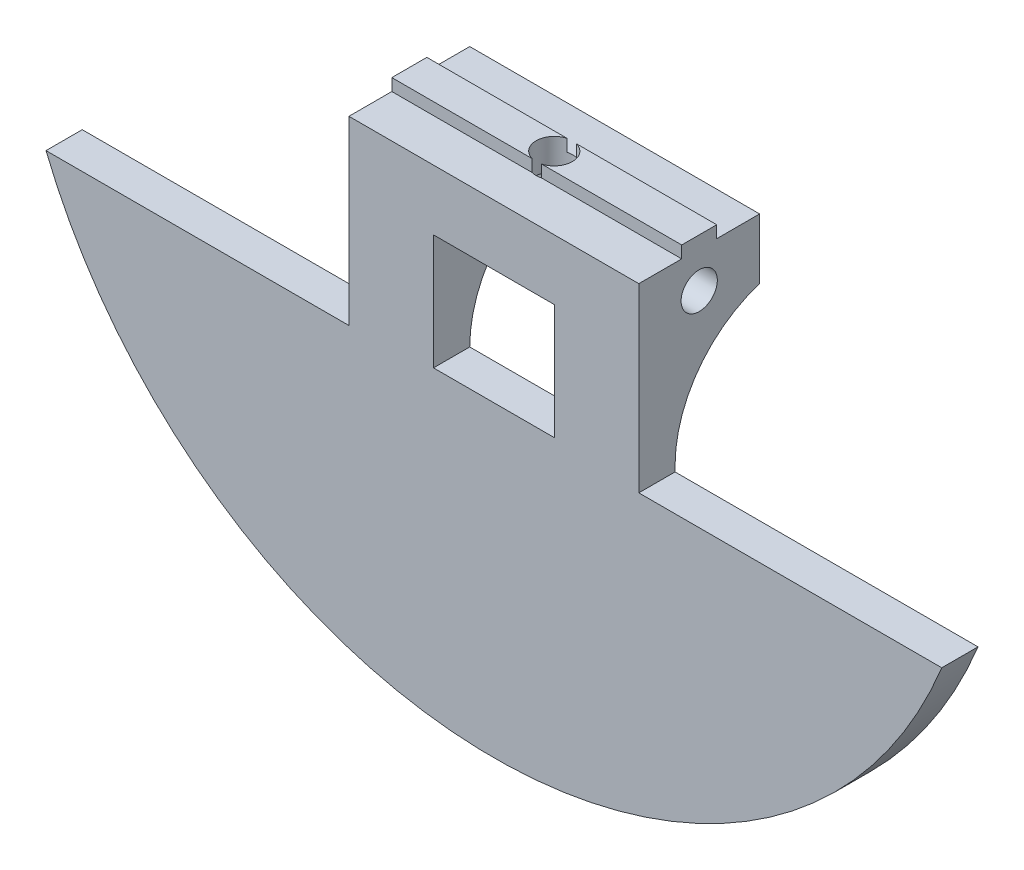
from build123d import *

# Parameters (mm, degrees)
BOSS_EXTRUDE1_DEPTH     = 10
SKETCH2_W               = 2.9
SKETCH2_H               = 1
BOSS_EXTRUDE2_DEPTH     = 24
SKETCH3_R               = 1.5
CUT_EXTRUDE1_DEPTH      = 57.178287621
CUT_EXTRUDE2_DEPTH      = 56.452682697
CUT_EXTRUDE2_DEPTH_BACK = 56.452682697
SKETCH5_W               = 7
SKETCH5_H               = 35
FILLET1_START           = 1.5000001
FILLET1_DEPTH           = 10.4999999
FILLET1_START_2         = -12
FILLET1_2_DEPTH         = 10.499986243
FILLET1_START_3         = -1.500013757
FILLET1_3_DEPTH         = 3.000013857
FILLET1_4_OUTLINE_W     = 1.5
FILLET1_4_OUTLINE_H     = 6.418167134
SKETCH6_W               = 10
SKETCH6_H               = 9.539392014
CUT_EXTRUDE3_DEPTH      = 56.452682532
SKETCH7_R               = 1.5
CUT_EXTRUDE4_DEPTH      = 65.101043817


with BuildPart() as part:
    # Sketch1 → Boss-Extrude1 (new body)
    with BuildSketch(Plane.XY):
        with BuildLine():
            Line((-37.080992435, -15), (-12, -15))
            Line((-12, -15), (-12, 0))
            Line((-12, 0), (12, 0))
            Line((12, 0), (12, -15))
            Line((12, -15), (37.080992435, -15))
            ThreePointArc((37.080992435, -15), (0, -40), (-37.080992435, -15))
        make_face()
    extrude(amount=BOSS_EXTRUDE1_DEPTH)

    # Sketch2 → Boss-Extrude2 (add)
    with BuildSketch(Plane(origin=(12, 0, 0), x_dir=(0, 0, -1), z_dir=(1, 0, 0))):
        with Locations((-5, 0.5)):
            Rectangle(SKETCH2_W, SKETCH2_H)
    extrude(amount=-BOSS_EXTRUDE2_DEPTH)

    # Sketch3 → Cut-Extrude1 (cut, through all)
    with BuildSketch(Plane(origin=(0, 1, 0), x_dir=(1, 0, 0), z_dir=(0, 1, 0))):
        with Locations(Location((0, -5, 0), (0, 0, 270))):
            Circle(SKETCH3_R)
    extrude(amount=-CUT_EXTRUDE1_DEPTH, mode=Mode.SUBTRACT)

    # Sketch5 → Cut-Extrude2 (cut, two sides: drawn at the far end of the back side and taken through both)
    with BuildSketch(Plane(origin=(0, 0, 0), x_dir=(0, 0, -1), z_dir=(1, 0, 0)).offset(-CUT_EXTRUDE2_DEPTH_BACK)):
        with Locations((-3.5, -22.5)):
            Rectangle(SKETCH5_W, SKETCH5_H)
    extrude(amount=CUT_EXTRUDE2_DEPTH + CUT_EXTRUDE2_DEPTH_BACK, mode=Mode.SUBTRACT)

    # Fillet1: read off the stored shape, not the designer's step
    # Fillet1 outline → Fillet1 (add)
    with BuildSketch(Plane.YZ.offset(FILLET1_START)):
        with BuildLine():
            Line((-5, 7), (-14.539392014, 7))
            ThreePointArc((-14.539392014, 7), (-8.623312231, 5.062257748), (-5, 0))
            Line((-5, 0), (-5, 7))
        make_face()
    extrude(amount=FILLET1_DEPTH)

    # Fillet1 2 outline → Fillet1 2 (add)
    with BuildSketch(Plane.YZ.offset(FILLET1_START_2)):
        with BuildLine():
            Line((-5, 7), (-14.539392014, 7))
            ThreePointArc((-14.539392014, 7), (-8.623312231, 5.062257748), (-5, 0))
            Line((-5, 0), (-5, 7))
        make_face()
    extrude(amount=FILLET1_2_DEPTH)

    # Fillet1 3 outline → Fillet1 3 (add)
    with BuildSketch(Plane.YZ.offset(FILLET1_START_3)):
        with BuildLine():
            Line((-5, 7), (-14.539392014, 7))
            ThreePointArc((-14.539392014, 7), (-8.623312231, 5.062257748), (-5, 0))
            Line((-5, 0), (-5, 7))
        make_face()
    extrude(amount=FILLET1_3_DEPTH)

    # Fillet1 4 outline → Fillet1 4 (revolve, cut)
    with BuildSketch(Plane.XY.offset(5)):
        with Locations((0.75, -8.209083567)):
            Rectangle(FILLET1_4_OUTLINE_W, FILLET1_4_OUTLINE_H)
    revolve(axis=Axis((0, 0, 5), (0, 1, 0)), mode=Mode.SUBTRACT)

    # Sketch6 → Cut-Extrude3 (cut, through all)
    with BuildSketch(Plane(origin=(0, 0, 0), x_dir=(-1, 0, 0), z_dir=(0, 0, -1))):
        with Locations((0, -9.769696007)):
            Rectangle(SKETCH6_W, SKETCH6_H)
    extrude(amount=-CUT_EXTRUDE3_DEPTH, mode=Mode.SUBTRACT)

    # Sketch7 → Cut-Extrude4 (cut, through all)
    with BuildSketch(Plane.ZY.offset(12)):
        with Locations((5, -3)):
            Circle(SKETCH7_R)
    extrude(amount=-CUT_EXTRUDE4_DEPTH, mode=Mode.SUBTRACT)


solid = part.part
